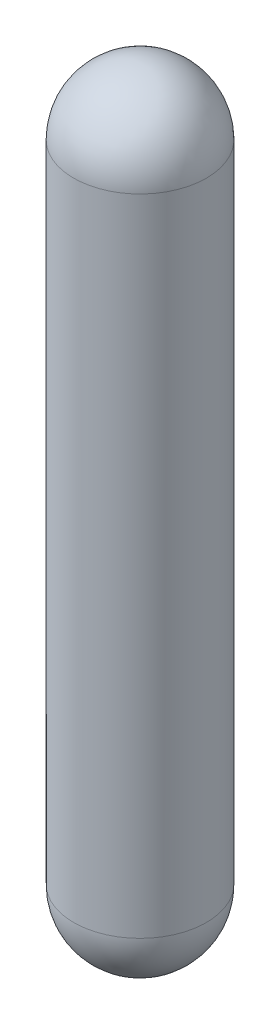
from build123d import *


with BuildPart() as part:
    # Sketch1 → Revolve1 (revolve)
    with BuildSketch(Plane.XY):
        with BuildLine():
            Line((0, 1990), (0, 2195))
            ThreePointArc((0, 2195), (144.956890143, 2134.956890143), (205, 1990))
            Line((205, 1990), (205, 0))
            ThreePointArc((205, 0), (144.956890143, -144.956890143), (0, -205))
            Line((0, -205), (0, 0))
            Line((0, 0), (0, 1990))
        make_face()
    revolve(axis=Axis((0, 0, 0), (0, 1, 0)))


solid = part.part
